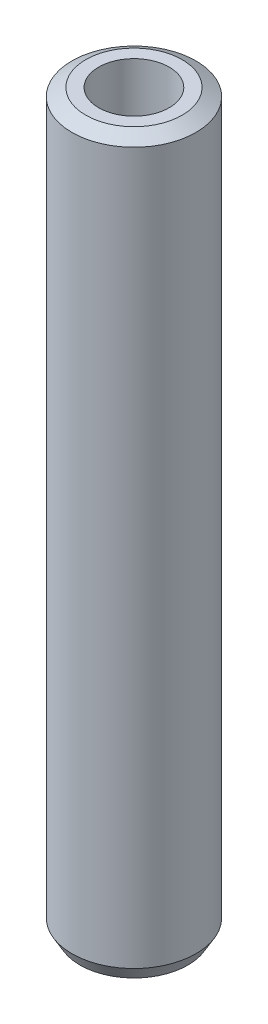
from build123d import *
from OCP.BRepFilletAPI import BRepFilletAPI_MakeChamfer

# Parameters (mm, degrees)
SKETCH1_R           = 32.5
BOSS_EXTRUDE1_DEPTH = 384.083358423
SKETCH2_R           = 18.475833051
CUT_EXTRUDE1_DEPTH  = 387.823637098
CHAMFER1_SIZE       = 4.193238492
CHAMFER1_SIZE2      = 7.262902116


with BuildPart() as part:
    # Sketch1 → Boss-Extrude1 (new body)
    with BuildSketch(Plane(origin=(0, 0, 0), x_dir=(1, 0, 0), z_dir=(0, 1, 0))):
        Circle(SKETCH1_R)
    extrude(amount=BOSS_EXTRUDE1_DEPTH)

    # Sketch2 → Cut-Extrude1 (cut, through all)
    with BuildSketch(Plane(origin=(0, 0, 0), x_dir=(1, 0, 0), z_dir=(0, 1, 0))):
        Circle(SKETCH2_R)
    extrude(amount=CUT_EXTRUDE1_DEPTH, mode=Mode.SUBTRACT)

    # Chamfer1: one chamfer whose edges measure the first distance from different faces: ONE call of the kernel's chamfer builder (chamfer() names one face for all edges)
    chamfer1_edges_1 = [part.edges().sort_by_distance(p)[0] for p in [
        (-32.5, 384.083358423, 0),
    ]]
    chamfer1_side_1 = [part.faces().sort_by_distance(p)[0] for p in [
        (-32.5, 192.041679212, 0),
    ]]
    chamfer1_edges_2 = [part.edges().sort_by_distance(p)[0] for p in [
        (-32.5, 0, 0),
    ]]
    chamfer1_side_2 = [part.faces().sort_by_distance(p)[0] for p in [
        (-31.580761184, 0, 0),
    ]]
    chamfer1 = BRepFilletAPI_MakeChamfer(part.part.solid().wrapped)
    for e in chamfer1_edges_1:
        chamfer1.Add(CHAMFER1_SIZE, CHAMFER1_SIZE2, e.wrapped, chamfer1_side_1[0].wrapped)  # the first distance lies on this face
    for e in chamfer1_edges_2:
        chamfer1.Add(CHAMFER1_SIZE, CHAMFER1_SIZE2, e.wrapped, chamfer1_side_2[0].wrapped)  # the first distance lies on this face
    add(Compound.cast(chamfer1.Shape()), mode=Mode.REPLACE)


solid = part.part
